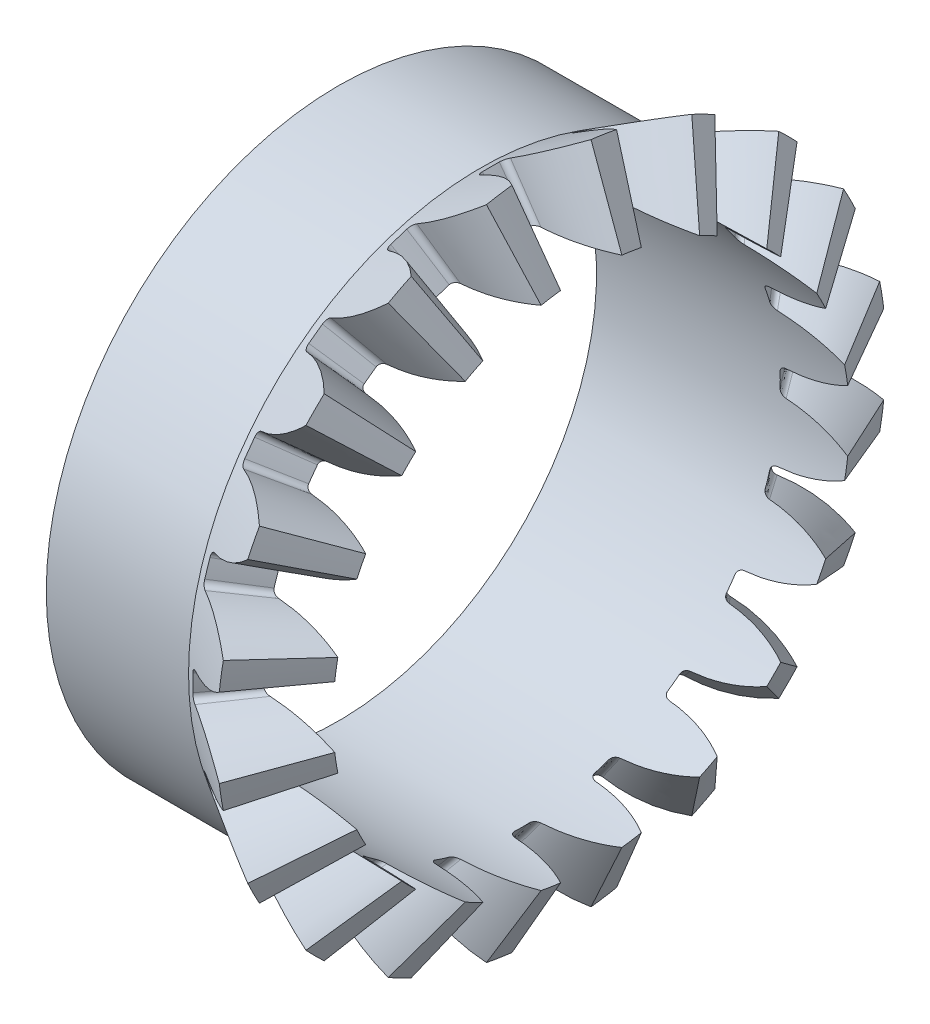
from build123d import *

# Parameters (mm, degrees)
TEETHCUTS_COUNT = 20
TEETHCUTS_ANGLE = 342
HUBSKE_R        = 2.261016722
HUB_DEPTH       = 1.101796136
BORSKE_R        = 2
BORE_DEPTH      = 3.0000508


with BuildPart() as part:
    # BasProSke → Base-Revolve (revolve)
    with BuildSketch(Plane(origin=(0, 0, 0), x_dir=(1, 0, 0), z_dir=(0, 1, 0)), mode=Mode.PRIVATE) as base_revolve_sk:
        Polygon((0, 0), (0, 2.261016722), (0.549567216, 2.590757051), (1.763431637, 0.259075703), (1.708474915, 0.226101671), (1.708474915, 0), align=None)
    revolve(base_revolve_sk.sketch.rotate(Axis((-10, 0, 0), (1, 0, 0)), 180), axis=Axis((-10, 0, 0), (1, 0, 0)))

    # ToothCut: read off the stored shape, not the designer's step
    # ToothCut: loft between two sections, ruled curve by curve
    toothcut_from = [
        Edge.make_bspline([(1.906326517, 0.004812632, -0.008590182), (1.901185085, 0.001727772, -0.015119264), (1.893603342, -0.002821273, -0.014484478), (1.889314418, -0.005394628, -0.007165832)], [0, 0, 0, 0, 1, 1, 1, 1], 3, [1, 0.747941435, 0.747941435, 1]),
        Edge.make_bspline([(1.889314418, -0.005394628, 0.007165832), (1.893603342, -0.002821273, 0.014484478), (1.901185085, 0.001727772, 0.015119264), (1.906326517, 0.004812632, 0.008590182)], [0, 0, 0, 0, 1, 1, 1, 1], 3, [1, 0.747941435, 0.747941435, 1]),
        Edge.make_bspline([(1.889314418, -0.005394628, -0.007165832), (1.888700948, -0.00576271, -0.006119003), (1.888227727, -0.006046642, -0.004977458), (1.88790527, -0.006240116, -0.003766562)], [0, 0, 0, 0, 1, 1, 1, 1], 3, [1, 0.992593456, 0.992593456, 1]),
        Edge.make_bspline([(1.88790527, -0.006240116, 0.003766562), (1.888227727, -0.006046642, 0.004977458), (1.888700948, -0.00576271, 0.006119003), (1.889314418, -0.005394628, 0.007165832)], [0, 0, 0, 0, 1, 1, 1, 1], 3, [1, 0.992593456, 0.992593456, 1]),
        Edge.make_bspline([(1.88790527, -0.006240116, -0.003766562), (1.887246928, -0.006635122, -0.001294344), (1.887246928, -0.006635122, 0.001294344), (1.88790527, -0.006240116, 0.003766562)], [0, 0, 0, 0, 1, 1, 1, 1], 3, [1, 0.970005404, 0.970005404, 1]),
        Edge.make_line((1.906326517, 0.004812632, 0.008590182), (1.906326517, 0.004812632, -0.008590182)),
    ]
    toothcut_to = [
        Edge.make_bspline([(0.577253369, 2.607368742, -0.339882132), (0.445058055, 2.528051555, -0.212107702), (0.286655489, 2.433010015, -0.134849338), (0.115818186, 2.330507633, -0.114824367)], [0, 0, 0, 0, 1, 1, 1, 1], 3, [1, 0.971017904, 0.971017904, 1]),
        Edge.make_bspline([(0.115818186, 2.330507633, 0.114824367), (0.286655489, 2.433010015, 0.134849338), (0.445058055, 2.528051555, 0.212107702), (0.577253369, 2.607368742, 0.339882132)], [0, 0, 0, 0, 1, 1, 1, 1], 3, [1, 0.971017904, 0.971017904, 1]),
        Edge.make_bspline([(0.115818186, 2.330507633, -0.114824367), (0.093127334, 2.316893123, -0.112164622), (0.078091654, 2.307871714, -0.092168463), (0.078794387, 2.308293354, -0.065585908)], [0, 0, 0, 0, 1, 1, 1, 1], 3, [1, 0.820798626, 0.820798626, 1]),
        Edge.make_bspline([(0.078794387, 2.308293354, 0.065585908), (0.078091654, 2.307871714, 0.092168463), (0.093127334, 2.316893123, 0.112164622), (0.115818186, 2.330507633, 0.114824367)], [0, 0, 0, 0, 1, 1, 1, 1], 3, [1, 0.820798626, 0.820798626, 1]),
        Edge.make_bspline([(0.078794387, 2.308293354, -0.065585908), (0.079950086, 2.308986774, -0.021868893), (0.079950086, 2.308986774, 0.021868893), (0.078794387, 2.308293354, 0.065585908)], [0, 0, 0, 0, 1, 1, 1, 1], 3, [1, 0.999683411, 0.999683411, 1]),
        Edge.make_line((0.577253369, 2.607368742, 0.339882132), (0.577253369, 2.607368742, -0.339882132)),
    ]
    toothcut = Solid(Shell([*[Face.make_surface_from_curves(toothcut_from[k], toothcut_to[k]) for k in range(6)], Face(Wire(toothcut_from)), Face(Wire(toothcut_to))]))
    add(toothcut, mode=Mode.SUBTRACT)

    # TeethCuts: ToothCut ×20 about axis
    teethcuts_axis = Axis((-10, 0, 0), (1, 0, 0))
    for i in range(1, TEETHCUTS_COUNT):
        add(toothcut.rotate(teethcuts_axis, i * TEETHCUTS_ANGLE / (TEETHCUTS_COUNT - 1)), mode=Mode.SUBTRACT)

    # HubSke → Hub (add)
    with BuildSketch(Plane.ZY):
        Circle(HUBSKE_R)
    extrude(amount=HUB_DEPTH)

    # BorSke → Bore (cut, symmetric)
    with BuildSketch(Plane(origin=(0, 0, 0), x_dir=(0, 0, -1), z_dir=(1, 0, 0))):
        with Locations(Location((0, 0, 0), (0, 0, 180))):
            Circle(BORSKE_R)
    extrude(amount=BORE_DEPTH, both=True, mode=Mode.SUBTRACT)


solid = part.part
